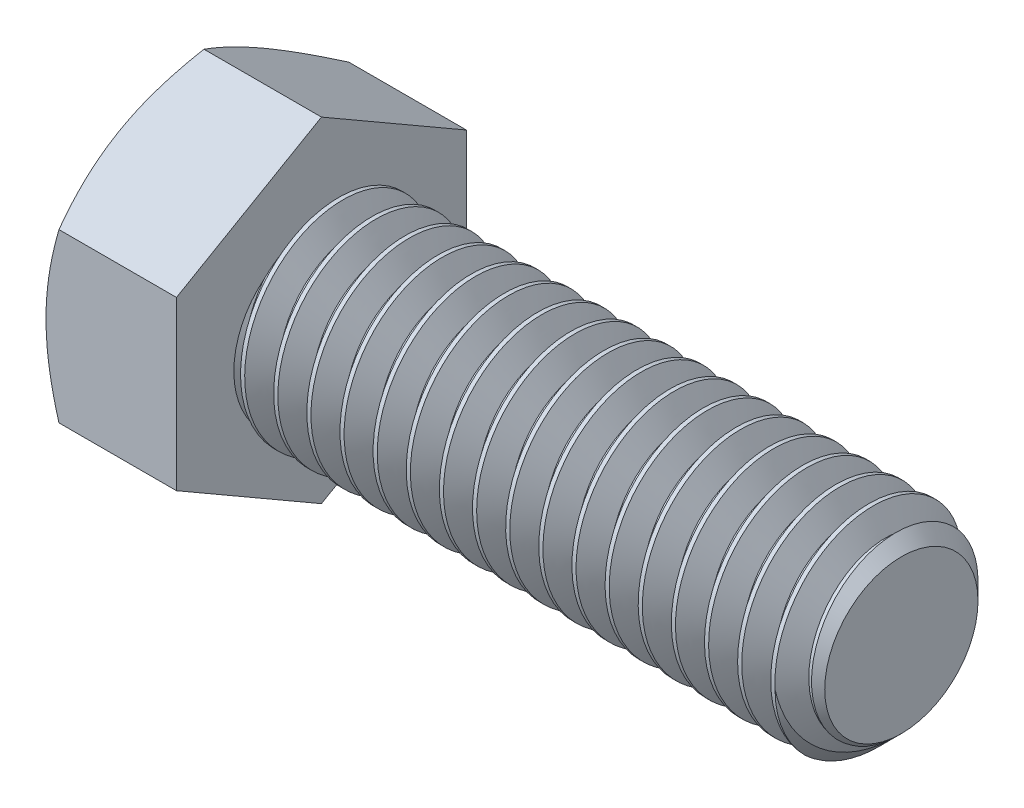
from build123d import *

# Parameters (mm, degrees)
SKETCH5_R           = 5.55625
BOSS_EXTRUDE3_DEPTH = 31.75
CHAMFER1_SIZE       = 1.360714286
CUT_SWEEP1_PITCH    = 1.814285714
BOSS_EXTRUDE4_DEPTH = 7.14375
SKETCH8_OUTSIDE_W   = 171.634
SKETCH8_OUTSIDE_H   = 174.088
SKETCH8_OUTSIDE_R   = 7.9375
CUT_EXTRUDE3_DEPTH  = 41.739819769
CUT_EXTRUDE3_DRAFT  = -60


with BuildPart() as part:
    # Sketch5 → Boss-Extrude3 (new body)
    with BuildSketch(Plane(origin=(19.446875, 0, 0), x_dir=(0, 0, -1), z_dir=(1, 0, 0))):
        Circle(SKETCH5_R)
    extrude(amount=-BOSS_EXTRUDE3_DEPTH)

    # Chamfer1
    chamfer1_edges = [part.edges().sort_by_distance(p)[0] for p in [
        (19.446875, 0, 5.55625),
    ]]
    chamfer(chamfer1_edges, length=CHAMFER1_SIZE)

    # Cut-Sweep1: the profile of Sketch10 profile screwed along a right-hand helix of 18.5 turns, 10 arcs to a turn; built about Z, then put on its axis
    cut_sweep1_z = Axis((0, 0, 0), (0, 0, 1))
    cut_sweep1_corners = [(5.55655, 0, 0.000173205), (4.377836861, 0, -0.680357143), (4.377836861, 0, -0.907142857), (5.55655, 0, -1.587673205)]
    with BuildLine(mode=Mode.PRIVATE) as cut_sweep1_profile:
        Line(cut_sweep1_corners[0], cut_sweep1_corners[1])
        Line(cut_sweep1_corners[1], cut_sweep1_corners[2])
        Line(cut_sweep1_corners[2], cut_sweep1_corners[3])
        Line(cut_sweep1_corners[3], cut_sweep1_corners[0])
    cut_sweep1_cap = Face(cut_sweep1_profile.wire())
    cut_sweep1_turn_angles = [0, 18, 36, 54, 72, 90, 108, 126, 144, 162, 180, 198, 216, 234, 252, 270, 288, 306, 324, 342, 360]
    cut_sweep1_turn_weights = [1, 0.9510565162951535, 1, 0.9510565162951535, 1, 0.9510565162951535, 1, 0.9510565162951535, 1, 0.9510565162951535, 1, 0.9510565162951535, 1, 0.9510565162951535, 1, 0.9510565162951535, 1, 0.9510565162951535, 1, 0.9510565162951535, 1]
    cut_sweep1_turn_rails = [Edge.make_bspline([Vector(p[0], p[1], 0).rotate(cut_sweep1_z, cut_sweep1_turn_angles[k]) / cut_sweep1_turn_weights[k] + Vector(0, 0, p[2] + CUT_SWEEP1_PITCH * cut_sweep1_turn_angles[k] / 360) for k in range(21)], [0, 0, 0, 1, 1, 2, 2, 3, 3, 4, 4, 5, 5, 6, 6, 7, 7, 8, 8, 9, 9, 10, 10, 10], 2, cut_sweep1_turn_weights) for p in cut_sweep1_corners]
    cut_sweep1_turn_sides = [Face.make_surface_from_curves(cut_sweep1_turn_rails[p[0]], cut_sweep1_turn_rails[p[1]]) for p in [(0, 1), (1, 2), (2, 3), (3, 0)]]
    cut_sweep1_last_angles = [6480, 6498, 6516, 6534, 6552, 6570, 6588, 6606, 6624, 6642, 6660]
    cut_sweep1_last_weights = [1, 0.9510565162951535, 1, 0.9510565162951535, 1, 0.9510565162951535, 1, 0.9510565162951535, 1, 0.9510565162951143, 1]
    cut_sweep1_last_rails = [Edge.make_bspline([Vector(p[0], p[1], 0).rotate(cut_sweep1_z, cut_sweep1_last_angles[k]) / cut_sweep1_last_weights[k] + Vector(0, 0, p[2] + CUT_SWEEP1_PITCH * cut_sweep1_last_angles[k] / 360) for k in range(11)], [0, 0, 0, 1, 1, 2, 2, 3, 3, 4, 4, 5, 5, 5], 2, cut_sweep1_last_weights) for p in cut_sweep1_corners]
    cut_sweep1_last_sides = [Face.make_surface_from_curves(cut_sweep1_last_rails[p[0]], cut_sweep1_last_rails[p[1]]) for p in [(0, 1), (1, 2), (2, 3), (3, 0)]]
    cut_sweep1 = Plane(origin=(19.446875, 0, 0), x_dir=(0, 1, 0), z_dir=(-1, 0, 0)) * Solid(Shell([*[p.moved(Location((0, 0, CUT_SWEEP1_PITCH * i))) for i in range(18) for p in cut_sweep1_turn_sides], *cut_sweep1_last_sides, cut_sweep1_cap, cut_sweep1_cap.rotate(cut_sweep1_z, 6660).moved(Location((0, 0, CUT_SWEEP1_PITCH * 6660 / 360)))]))
    add(cut_sweep1, mode=Mode.SUBTRACT)

    # Sketch6 → Boss-Extrude4 (add)
    with BuildSketch(Plane.ZY.offset(12.303125)):
        Polygon((7.9375, 4.582717762), (0, 9.165435523), (-7.9375, 4.582717762), (-7.9375, -4.582717762), (0, -9.165435523), (7.9375, -4.582717762), align=None)
    extrude(amount=BOSS_EXTRUDE4_DEPTH)


with BuildPart() as cut_extrude3_tool:
    # Sketch8 outside → Cut-Extrude3 (with draft: the straight prism first)
    with BuildSketch(Plane.ZY.offset(19.446875)):
        Rectangle(SKETCH8_OUTSIDE_W, SKETCH8_OUTSIDE_H)
        Circle(SKETCH8_OUTSIDE_R, mode=Mode.SUBTRACT)
    extrude(amount=-CUT_EXTRUDE3_DEPTH)
    # Cut-Extrude3: the draft: its side faces are tilted about the plane it starts from
    cut_extrude3_sides = [cut_extrude3_tool.faces().sort_by_distance(p)[0] for p in [
        (1.423034885, -87.044, 0),
        (1.423034885, 0, 85.817),
        (1.423034885, 87.044, 0),
        (1.423034885, 0, -85.817),
        (1.423034885, 0, -7.9375),
    ]]
    draft(cut_extrude3_sides, Plane.ZY.offset(19.446875), CUT_EXTRUDE3_DRAFT)


with BuildPart() as part_1:
    add(part.part)

    # Cut-Extrude3: cut by cut_extrude3_tool
    add(cut_extrude3_tool.part, mode=Mode.SUBTRACT)


solid = part_1.part
